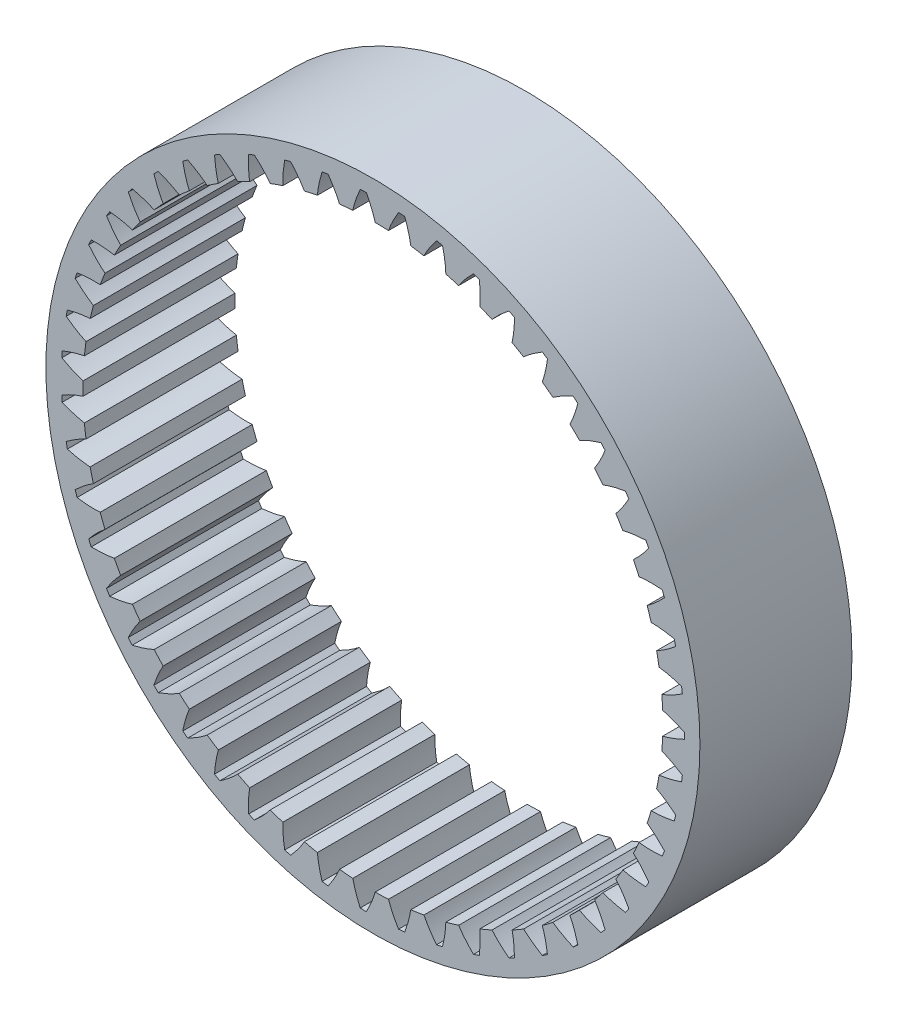
from build123d import *

# Parameters (mm, degrees)
SKETCH3_R           = 14.413170677
SKETCH3_R_2         = 12.779268244
BOSS_EXTRUDE2_DEPTH = 6.7
CUT_EXTRUDE2_DEPTH  = 22.456210707
CIRPATTERN1_COUNT   = 51


with BuildPart() as part:
    # Sketch3 → Boss-Extrude2 (new body)
    with BuildSketch(Plane.XY):
        Circle(SKETCH3_R)
        Circle(SKETCH3_R_2, mode=Mode.SUBTRACT)
    extrude(amount=BOSS_EXTRUDE2_DEPTH)

    # Sketch1 → Cut-Extrude2 (cut, through all)
    with BuildSketch(Plane.XY):
        with BuildLine():
            Line((13.72615817, 0.135733799), (13.72615817, -0.135733799))
            add(Edge.make_bspline(
                [(12.769715215, -0.494035854), (12.776574111, -0.492330686), (12.790035774, -0.488931181), (12.821574661, -0.480855079), (12.847555146, -0.473780112), (12.883037295, -0.464047997), (12.912691253, -0.45547992), (12.945746782, -0.445784781), (12.976614207, -0.436365358), (13.008699632, -0.426370641), (13.039899017, -0.416347103), (13.071555606, -0.405937604), (13.102741837, -0.395425085), (13.134199694, -0.384554527), (13.172321724, -0.371117615), (13.218755008, -0.354199935), (13.271565793, -0.334431224), (13.33373375, -0.310033015), (13.393326926, -0.286021333), (13.457142781, -0.259042765), (13.513348434, -0.234899297), (13.581176706, -0.204218207), (13.628997859, -0.182472569), (13.689081493, -0.153716373), (13.713457548, -0.14193902), (13.72615817, -0.135733799)],
                knots=[0.060378475, 0.060378475, 0.060378475, 0.060378475, 0.060378475, 0.088008109, 0.11563793, 0.14326768, 0.170897428, 0.198527297, 0.22615695, 0.253786788, 0.281416525, 0.309046301, 0.336676096, 0.364305819, 0.391935638, 0.419565403, 0.472503509, 0.527763064, 0.583022611, 0.638282123, 0.693541711, 0.748801217, 0.804060785, 0.859320271, 0.914579864, 0.914579864, 0.914579864, 0.914579864, 0.914579864], degree=4))
            Line((12.769715215, -0.494035854), (12.769715215, 0.494035854))
            add(Edge.make_bspline(
                [(12.769715215, 0.494035854), (12.776574111, 0.492330686), (12.790035774, 0.488931181), (12.821574661, 0.480855079), (12.847555146, 0.473780112), (12.883037295, 0.464047997), (12.912691253, 0.45547992), (12.945746782, 0.445784781), (12.976614207, 0.436365358), (13.008699632, 0.426370641), (13.039899017, 0.416347103), (13.071555606, 0.405937604), (13.102741837, 0.395425085), (13.134199694, 0.384554527), (13.172321724, 0.371117615), (13.218755008, 0.354199935), (13.271565793, 0.334431224), (13.33373375, 0.310033015), (13.393326926, 0.286021333), (13.457142781, 0.259042765), (13.513348434, 0.234899297), (13.581176706, 0.204218207), (13.628997859, 0.182472569), (13.689081493, 0.153716373), (13.713457548, 0.14193902), (13.72615817, 0.135733799)],
                knots=[0.060378475, 0.060378475, 0.060378475, 0.060378475, 0.060378475, 0.088008109, 0.11563793, 0.14326768, 0.170897428, 0.198527297, 0.22615695, 0.253786788, 0.281416525, 0.309046301, 0.336676096, 0.364305819, 0.391935638, 0.419565403, 0.472503509, 0.527763064, 0.583022611, 0.638282123, 0.693541711, 0.748801217, 0.804060785, 0.859320271, 0.914579864, 0.914579864, 0.914579864, 0.914579864, 0.914579864], degree=4))
        make_face()
    cut_extrude2 = extrude(amount=CUT_EXTRUDE2_DEPTH, mode=Mode.SUBTRACT)

    # CirPattern1: Cut-Extrude2 ×51 about axis
    cirpattern1_axis = Axis((0, 0, 6.928898804), (0, 0, -1))
    for i in range(1, CIRPATTERN1_COUNT):
        add(cut_extrude2.rotate(cirpattern1_axis, i * 360 / CIRPATTERN1_COUNT), mode=Mode.SUBTRACT)


solid = part.part
